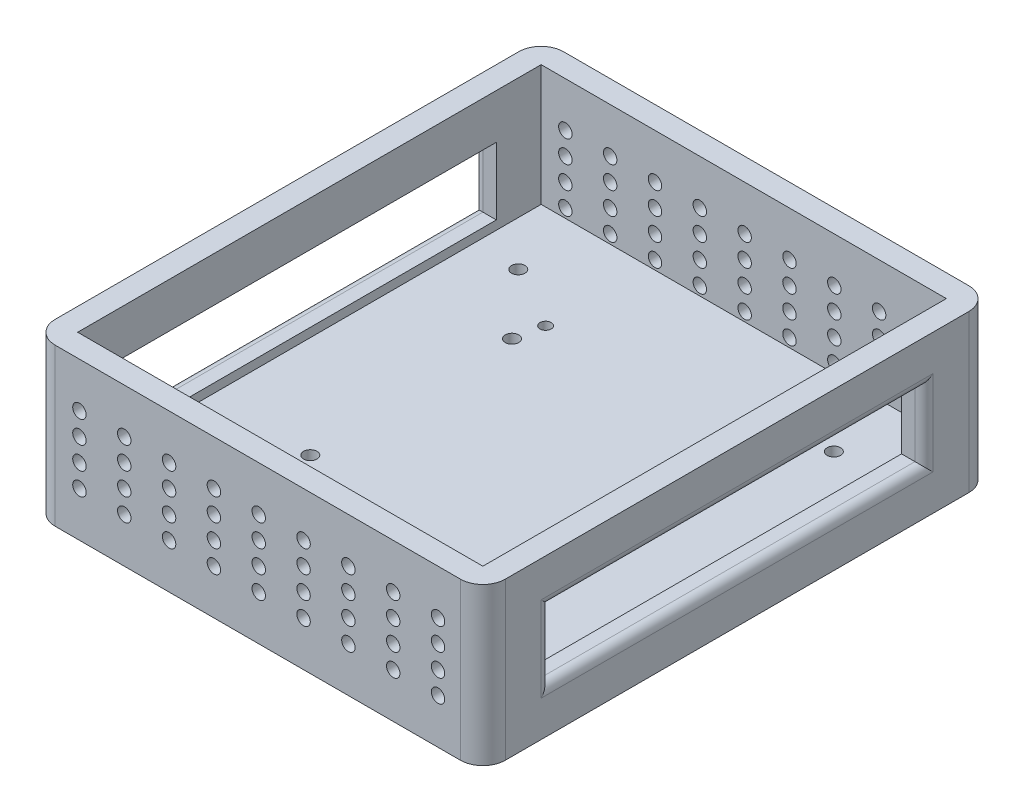
from build123d import *

# Parameters (mm, degrees)
SKETCH1_W            = 100.4
SKETCH1_H            = 113.4
BOSS_EXTRUDE2_DEPTH  = 35
SKETCH2_W            = 90.4
SKETCH2_H            = 103.4
CUT_EXTRUDE1_DEPTH   = 27
FILLET4_R            = 5
SKETCH4_W            = 83.4
SKETCH4_H            = 15
CUT_EXTRUDE3_DEPTH   = 123
FILLET5_R            = 2
FILLET6_R            = 2
SKETCH3_R            = 1.5
CUT_EXTRUDE4_DEPTH   = 123
LPATTERN3_COUNT      = 9
LPATTERN3_PITCH      = 10
LPATTERN3_COUNT_DIR2 = 4
LPATTERN3_PITCH_DIR2 = 5
SKETCH5_R            = 1.5
CUT_EXTRUDE5_DEPTH   = 37
SKETCH6_R            = 3
CUT_EXTRUDE6_DEPTH   = 4
SKETCH7_R            = 1.25
CUT_EXTRUDE7_DEPTH   = 17
SKETCH8_R            = 1.5
CUT_EXTRUDE8_DEPTH   = 9
SKETCH9_R            = 3
CUT_EXTRUDE9_DEPTH   = 4


with BuildPart() as part:
    # Sketch1 → Boss-Extrude2 (new body)
    with BuildSketch(Plane(origin=(0, 0, 0), x_dir=(1, 0, 0), z_dir=(0, 1, 0))):
        Rectangle(SKETCH1_W, SKETCH1_H)
    extrude(amount=BOSS_EXTRUDE2_DEPTH)

    # Sketch2 → Cut-Extrude1 (cut)
    with BuildSketch(Plane(origin=(0, 35, 0), x_dir=(1, 0, 0), z_dir=(0, 1, 0))):
        Rectangle(SKETCH2_W, SKETCH2_H)
    extrude(amount=-CUT_EXTRUDE1_DEPTH, mode=Mode.SUBTRACT)

    # Fillet4
    fillet4_edges = [part.edges().sort_by_distance(p)[0] for p in [
        (50.2, 17.5, -56.7),
        (-50.2, 17.5, -56.7),
        (-50.2, 17.5, 56.7),
        (50.2, 17.5, 56.7),
    ]]
    fillet(fillet4_edges, radius=FILLET4_R)

    # Sketch4 → Cut-Extrude3 (cut)
    with BuildSketch(Plane(origin=(50.2, 0, 0), x_dir=(0, 0, -1), z_dir=(1, 0, 0))):
        with Locations((0, 17.5)):
            Rectangle(SKETCH4_W, SKETCH4_H)
    extrude(amount=-CUT_EXTRUDE3_DEPTH, mode=Mode.SUBTRACT)

    # Fillet5
    fillet5_edges = [part.edges().sort_by_distance(p)[0] for p in [
        (50.2, 17.5, 41.7),
        (50.2, 25, 0),
        (50.2, 17.5, -41.7),
        (50.2, 10, 0),
    ]]
    fillet(fillet5_edges, radius=FILLET5_R)

    # Fillet6
    fillet6_edges = [part.edges().sort_by_distance(p)[0] for p in [
        (-50.2, 17.5, 41.7),
        (-50.2, 25, 0),
        (-50.2, 17.5, -41.7),
        (-50.2, 10, 0),
    ]]
    fillet(fillet6_edges, radius=FILLET6_R)

    # Sketch3 → Cut-Extrude4 (cut)
    with BuildSketch(Plane(origin=(0, 0, -56.7), x_dir=(-1, 0, 0), z_dir=(0, 0, -1))):
        with Locations((-40.2, 10)):
            Circle(SKETCH3_R)
    cut_extrude4 = extrude(amount=-CUT_EXTRUDE4_DEPTH, mode=Mode.SUBTRACT)

    # LPattern3: Cut-Extrude4 9 × 4
    with Locations(*[(-i * LPATTERN3_PITCH, j * LPATTERN3_PITCH_DIR2, 0) for i in range(LPATTERN3_COUNT) for j in range(LPATTERN3_COUNT_DIR2) if (i, j) != (0, 0)]):
        add(cut_extrude4, mode=Mode.SUBTRACT)

    # Sketch5 → Cut-Extrude5 (cut)
    with BuildSketch(Plane(origin=(0, 8, 0), x_dir=(1, 0, 0), z_dir=(0, 1, 0))):
        with Locations((-22.5, 22.5)):
            Circle(SKETCH5_R)
        with Locations((22.5, 22.5)):
            Circle(SKETCH5_R)
        with Locations((-22.5, -22.5)):
            Circle(SKETCH5_R)
        with Locations((22.5, -22.5)):
            Circle(SKETCH5_R)
    extrude(amount=-CUT_EXTRUDE5_DEPTH, mode=Mode.SUBTRACT)

    # Sketch6 → Cut-Extrude6 (cut)
    with BuildSketch(Plane.XZ):
        with Locations((-22.5, 22.5)):
            Circle(SKETCH6_R)
        with Locations((-22.5, -22.5)):
            Circle(SKETCH6_R)
        with Locations((22.5, 22.5)):
            Circle(SKETCH6_R)
        with Locations((22.5, -22.5)):
            Circle(SKETCH6_R)
    extrude(amount=-CUT_EXTRUDE6_DEPTH, mode=Mode.SUBTRACT)

    # Sketch7 → Cut-Extrude7 (cut)
    with BuildSketch(Plane.XZ):
        with Locations((-21.25, 28.75)):
            Circle(SKETCH7_R)
        with Locations((-21.25, -28.75)):
            Circle(SKETCH7_R)
        with Locations((21.25, -28.75)):
            Circle(SKETCH7_R)
        with Locations((21.25, 28.75)):
            Circle(SKETCH7_R)
    extrude(amount=-CUT_EXTRUDE7_DEPTH, mode=Mode.SUBTRACT)

    # Sketch8 → Cut-Extrude8 (cut)
    with BuildSketch(Plane(origin=(0, 8, 0), x_dir=(1, 0, 0), z_dir=(0, 1, 0))):
        with Locations((-35.2, 36.6)):
            Circle(SKETCH8_R)
        with Locations((35.2, 36.6)):
            Circle(SKETCH8_R)
        with Locations((-35.2, -36.7)):
            Circle(SKETCH8_R)
        with Locations((35.2, -36.7)):
            Circle(SKETCH8_R)
    extrude(amount=-CUT_EXTRUDE8_DEPTH, mode=Mode.SUBTRACT)

    # Sketch9 → Cut-Extrude9 (cut)
    with BuildSketch(Plane.XZ):
        with Locations((-35.2, 36.7)):
            Circle(SKETCH9_R)
        with Locations((35.2, 36.7)):
            Circle(SKETCH9_R)
        with Locations((-35.2, -36.6)):
            Circle(SKETCH9_R)
        with Locations((35.2, -36.6)):
            Circle(SKETCH9_R)
    extrude(amount=-CUT_EXTRUDE9_DEPTH, mode=Mode.SUBTRACT)


solid = part.part
